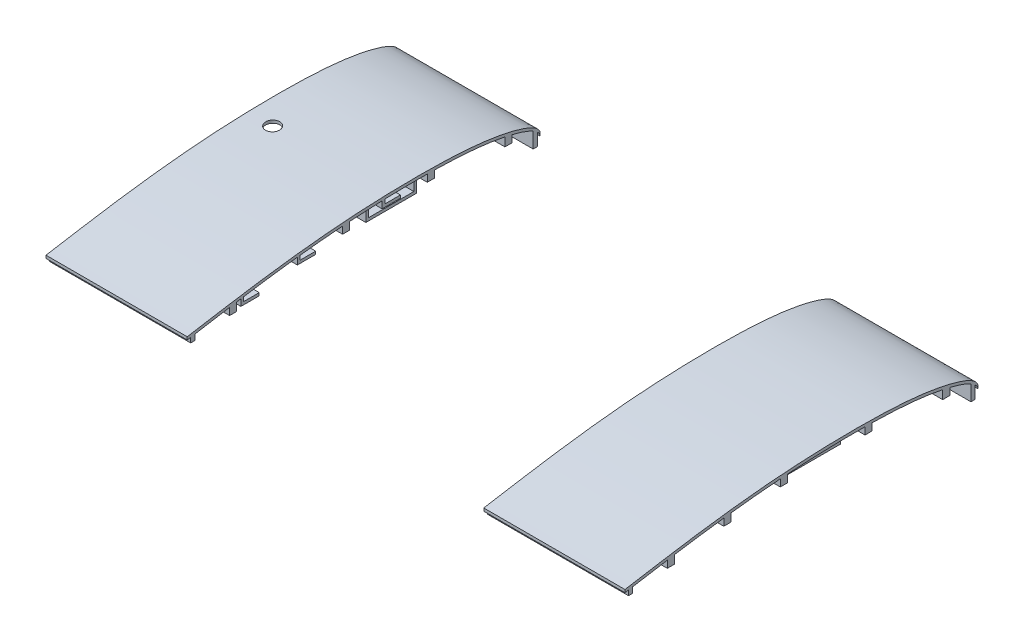
from build123d import *

# Parameters (mm, degrees)
PROFILOCONRINFORZISINISTRO_DEPTH = 105
PROFILOCONRINFORZIDESTRO_DEPTH   = 105
CASSETTOGPS_DEPTH                = 30
CASSETTOGPS_DEPTH_BACK           = 28
SCHIZZO11_W                      = 55
SCHIZZO11_H                      = 12.513248872
CHIUSURACASSETTOGPS_DEPTH        = 2
CASSETTOTELEMETRIA_DEPTH         = 5
CASSETTOTELEMETRIA_DEPTH_BACK    = 45
SCHIZZO13_W                      = 18
SCHIZZO13_H                      = 10.410736535
CHIUSURACASSETTOTELEMETRIA_DEPTH = 2
SCHIZZO14_R                      = 5
FOROANTENNA_DEPTH                = 246.014584546
INCASTRIDENTELLISINISTRA_DEPTH   = 16
INCASTRIDENTELLIDESTRA_DEPTH     = 16
SCHIZZO18_W                      = 3
SCHIZZO18_H                      = 4
INCASTRIVERTICALISINISTRA_DEPTH  = 105
SCHIZZO19_W                      = 3
SCHIZZO19_H                      = 4
INCASTRIVERTICALIDESTRA_DEPTH    = 105
SCHIZZO20_W                      = 5
SCHIZZO20_H                      = 100
TAGLIO_ESTRUSIONE1_DEPTH         = 310
TAGLIO_ESTRUSIONE2_DEPTH         = 37.5
TAGLIO_ESTRUSIONE3_DEPTH         = 37.5


with BuildPart() as part:
    # ProfiloSinistro → ProfiloConRinforziSinistro (new body)
    with BuildSketch(Plane(origin=(-210, 0, 0), x_dir=(0, 0, -1), z_dir=(1, 0, 0))):
        with BuildLine():
            Line((-125, 43.17), (-125, 41.17))
            add(Edge.make_bspline(
                [(-95.000000007, 46.142964166), (-96.383559705, 45.913395163), (-100.327264747, 45.260130481), (-106.363413337, 44.351808874), (-112.746440904, 43.268942418), (-117.622069366, 42.415861917), (-121.644529332, 41.722864946), (-123.32839844, 41.416216765), (-124.999773563, 41.177977377), (-125, 41.17)],
                knots=[0.940049334, 0.940049334, 0.940049334, 0.940049334, 0.948342069, 0.963693004, 0.976235918, 0.986320059, 0.993788799, 0.998424035, 1, 1, 1, 1], degree=3))
            Line((-95.000000007, 46.142964166), (-95.000000007, 41.142964164))
            Line((-95.000000007, 41.142964164), (-90.000000009, 41.142964164))
            Line((-90.000000009, 41.142964164), (-90.000000009, 46.962212447))
            add(Edge.make_bspline(
                [(-55.000000002, 51.955469397), (-56.843173428, 51.723048955), (-62.307110823, 51.017942767), (-71.163081699, 49.802379124), (-80.98405898, 48.34835521), (-87.188777011, 47.411025673), (-90.000000009, 46.962212447)],
                knots=[0.860366078, 0.860366078, 0.860366078, 0.860366078, 0.871352858, 0.892947449, 0.913230871, 0.930064087, 0.930064087, 0.930064087, 0.930064087], degree=3))
            Line((-55.000000002, 51.955469397), (-55.000000002, 46.955469399))
            Line((-55.000000002, 46.955469399), (-50.000000002, 46.955469399))
            Line((-50.000000002, 46.955469399), (-50.000000002, 52.572388125))
            add(Edge.make_bspline(
                [(-14.999999994, 56.019629308), (-18.379417541, 55.767295402), (-25.814226898, 55.157245068), (-37.191375056, 54.051586985), (-45.474241435, 53.116208177), (-49.708350468, 52.607567246), (-50.000000002, 52.572388125)],
                knots=[0.781098899, 0.781098899, 0.781098899, 0.781098899, 0.801140184, 0.825214387, 0.848697424, 0.850434727, 0.850434727, 0.850434727, 0.850434727], degree=3))
            Line((-14.999999994, 56.019629308), (-14.999999994, 51.019629308))
            Line((-14.999999994, 51.019629308), (-9.999999995, 51.019629308))
            Line((-9.999999995, 51.019629308), (-9.999999995, 56.374624202))
            add(Edge.make_bspline(
                [(45.000080295, 57.965037997), (42.188516749, 57.996145507), (35.352175978, 58.022351628), (24.403000114, 57.89671529), (12.111174018, 57.553385062), (0.613038682, 57.037092747), (-6.769741769, 56.592120119), (-9.999999995, 56.374624202)],
                knots=[0.662723528, 0.662723528, 0.662723528, 0.662723528, 0.679351894, 0.703152303, 0.727478208, 0.752070739, 0.771217511, 0.771217511, 0.771217511, 0.771217511], degree=3))
            Line((45.000080295, 57.965037997), (45.000080295, 52.887723635))
            Line((45.000080295, 52.887723635), (50.000080294, 52.887723635))
            Line((50.000080294, 52.887723635), (50.000080294, 57.887723634))
            add(Edge.make_bspline(
                [(100.000080297, 53.212006285), (98.926491228, 53.435110632), (95.159056127, 54.175343839), (88.392626594, 55.267834907), (79.42697156, 56.329429016), (69.667089926, 57.130903997), (59.768729904, 57.634304846), (53.131645999, 57.825139827), (50.000080294, 57.887723634)],
                knots=[0.553736641, 0.553736641, 0.553736641, 0.553736641, 0.560220779, 0.576438923, 0.594258689, 0.613600245, 0.634342386, 0.65286581, 0.65286581, 0.65286581, 0.65286581], degree=3))
            Line((100.000080297, 53.212006285), (100.000080297, 47.078985013))
            Line((100.000080297, 47.078985013), (105.000080295, 47.078985013))
            Line((105.000080295, 47.078985013), (105.000080295, 52.078985012))
            add(Edge.make_bspline(
                [(125.000080295, 41.18724985), (125.000080295, 41.245823225), (124.966052724, 41.968038807), (124.187400758, 43.475684336), (122.271136483, 45.408352423), (119.230092759, 47.28817212), (115.119057196, 49.0835942), (110.255807, 50.701301925), (106.750993245, 51.647024395), (105.000080295, 52.078985012)],
                knots=[0.496943959, 0.496943959, 0.496943959, 0.496943959, 0.497289785, 0.501214273, 0.50645795, 0.513356957, 0.522168632, 0.53296597, 0.543630389, 0.543630389, 0.543630389, 0.543630389], degree=3))
            Line((125.000080295, 41.18724985), (125.000080295, 43.187249851))
            add(Edge.make_bspline(
                [(125.000080295, 43.187249851), (125.000080295, 43.245823226), (124.966052724, 43.968038809), (124.187400758, 45.475684337), (122.271136483, 47.408352424), (119.230092759, 49.288172121), (115.119057196, 51.083594202), (109.925069532, 52.811318178), (103.701247778, 54.453896488), (96.50282788, 55.958381759), (88.392626594, 57.267834908), (79.42697156, 58.329429017), (69.667089926, 59.130903998), (59.183463502, 59.664069738), (48.06862374, 59.961989705), (36.433050972, 60.034754131), (24.403000114, 59.896715291), (12.111174018, 59.553385064), (-0.311615819, 58.995573667), (-12.743791097, 58.22233187), (-25.072384382, 57.229339074), (-37.191375056, 56.051586986), (-48.989074322, 54.719280346), (-60.352364446, 53.286249729), (-71.163081698, 51.802379125), (-81.300441402, 50.301513884), (-90.560350587, 48.901221768), (-98.977157043, 47.463295127), (-106.363413336, 46.351808874), (-112.746440904, 45.268942417), (-117.622069366, 44.415861917), (-121.644529332, 43.722864946), (-123.32839844, 43.416216765), (-124.999773563, 43.177977377), (-125, 43.17)],
                knots=[0.496943959, 0.496943959, 0.496943959, 0.496943959, 0.497289785, 0.501214273, 0.50645795, 0.513356957, 0.522168632, 0.53296597, 0.545689209, 0.560220779, 0.576438923, 0.594258689, 0.613600245, 0.634342386, 0.656331109, 0.679351894, 0.703152303, 0.727478208, 0.752070739, 0.776691164, 0.801140184, 0.825214387, 0.848697424, 0.871352858, 0.892947449, 0.913230871, 0.931955467, 0.948342069, 0.963693004, 0.976235918, 0.986320059, 0.993788799, 0.998424035, 1, 1, 1, 1], degree=3))
        make_face()
    extrude(amount=PROFILOCONRINFORZISINISTRO_DEPTH)

    # Schizzo12 → CassettoTelemetria (add, two sides: drawn at the far end of the back side and taken through both)
    with BuildSketch(Plane.ZY.offset(157.5).offset(-CASSETTOTELEMETRIA_DEPTH_BACK)):
        Polygon((-45.000010196, 57.983772629), (-45.000010196, 42.4769871), (-9.000010196, 42.4769871), (-9.000010196, 57.4769871), (-11.000010196, 57.4769871), (-11.000010196, 44.4769871), (-43.000010196, 44.4769871), (-43.000010196, 57.983772629), align=None)
    extrude(amount=CASSETTOTELEMETRIA_DEPTH + CASSETTOTELEMETRIA_DEPTH_BACK)

    # Schizzo13 → ChiusuraCassettoTelemetria (add)
    with BuildSketch(Plane.ZY.offset(162.5)):
        with Locations((-36.000010196, 47.682355368)):
            Rectangle(SCHIZZO13_W, SCHIZZO13_H)
    extrude(amount=-CHIUSURACASSETTOTELEMETRIA_DEPTH)

    # Schizzo14 → ForoAntenna (cut, through all)
    with BuildSketch(Plane.XZ.offset(-42.4769871)):
        with Locations(Location((-187.5, -18.000010196, 0), (0, 0, 270))):
            Circle(SCHIZZO14_R)
    extrude(amount=-FOROANTENNA_DEPTH, mode=Mode.SUBTRACT)

    # Schizzo15 → IncastriDentelliSinistra (add)
    with BuildSketch(Plane.ZY.offset(105)):
        Polygon((87, 47.739245188), (87, 42.739245188), (74, 42.739245188), (74, 44.739245188), (85, 44.739245188), (85, 47.739245188), align=None)
        Polygon((-13.000080295, 57.617856056), (-13.000080295, 52.617856056), (-26.000080295, 52.617856056), (-26.000080295, 54.617856056), (-15.000080295, 54.617856056), (-15.000080295, 57.617856056), align=None)
        Polygon((47, 53.1611578), (47, 48.1611578), (34, 48.1611578), (34, 50.1611578), (45, 50.1611578), (45, 53.1611578), align=None)
    extrude(amount=INCASTRIDENTELLISINISTRA_DEPTH)

    # Schizzo18 → IncastriVerticaliSinistra (add)
    with BuildSketch(Plane.ZY.offset(210)):
        with Locations((121, 40.092491928)):
            Rectangle(SCHIZZO18_W, SCHIZZO18_H)
        Polygon((-123.000080295, 45.762545658), (-120.000080295, 46.762545658), (-120.000080295, 35.762545658), (-123.000080295, 35.762545658), align=None)
    extrude(amount=-INCASTRIVERTICALISINISTRA_DEPTH)


with BuildPart() as body_2:
    # Schizzo5 → ProfiloConRinforziDestro (new body)
    with BuildSketch(Plane(origin=(210, 0, 0), x_dir=(0, 0, -1), z_dir=(1, 0, 0))):
        with BuildLine():
            Line((-125, 43.17), (-125, 41.17))
            add(Edge.make_bspline(
                [(-95, 46.142964166), (-96.383559701, 45.913395163), (-100.327264745, 45.26013048), (-106.363413337, 44.351808874), (-112.746440905, 43.268942417), (-117.622069366, 42.415861917), (-121.644529333, 41.722864946), (-123.32839844, 41.416216765), (-124.999773563, 41.177977377), (-125, 41.17)],
                knots=[0.940049334, 0.940049334, 0.940049334, 0.940049334, 0.948342069, 0.963693004, 0.976235918, 0.986320059, 0.993788799, 0.998424035, 1, 1, 1, 1], degree=3))
            Line((-95, 46.142964166), (-95, 41.142964166))
            Line((-95, 41.142964166), (-90, 41.142964166))
            Line((-90, 41.142964166), (-90, 46.962212449))
            add(Edge.make_bspline(
                [(-55, 51.955469401), (-56.843173427, 51.723048958), (-62.307110822, 51.01794277), (-71.1630817, 49.802379126), (-80.984058977, 48.348355212), (-87.188777005, 47.411025675), (-90, 46.962212449)],
                knots=[0.860366078, 0.860366078, 0.860366078, 0.860366078, 0.871352858, 0.892947449, 0.913230871, 0.930064087, 0.930064087, 0.930064087, 0.930064087], degree=3))
            Line((-55, 51.955469401), (-55, 46.955469399))
            Line((-55, 46.955469399), (-50, 46.955469399))
            Line((-50, 46.955469399), (-50, 52.572388127))
            add(Edge.make_bspline(
                [(-15, 56.019629309), (-18.379417546, 55.767295403), (-25.814226902, 55.157245069), (-37.191375059, 54.051586986), (-45.474241436, 53.116208179), (-49.708350467, 52.607567248), (-50, 52.572388127)],
                knots=[0.781098899, 0.781098899, 0.781098899, 0.781098899, 0.801140184, 0.825214387, 0.848697424, 0.850434727, 0.850434727, 0.850434727, 0.850434727], degree=3))
            Line((-15, 56.019629309), (-15, 51.019629308))
            Line((-15, 51.019629308), (-10.000000006, 51.019629308))
            Line((-10.000000006, 51.019629308), (-10.000000006, 56.374624203))
            add(Edge.make_bspline(
                [(45.000080282, 57.965037999), (42.188516738, 57.996145508), (35.35217597, 58.022351629), (24.403000109, 57.896715292), (12.111174012, 57.553385064), (0.613038675, 57.037092748), (-6.769741777, 56.59212012), (-10.000000006, 56.374624203)],
                knots=[0.662723528, 0.662723528, 0.662723528, 0.662723528, 0.679351894, 0.703152303, 0.727478208, 0.752070739, 0.771217511, 0.771217511, 0.771217511, 0.771217511], degree=3))
            Line((45.000080282, 57.965037999), (45.000080282, 52.887723636))
            Line((45.000080282, 52.887723636), (50.000080295, 52.887723636))
            Line((50.000080295, 52.887723636), (50.000080295, 57.887723635))
            add(Edge.make_bspline(
                [(100.000080295, 53.212006286), (98.926491227, 53.435110633), (95.159056127, 54.17534384), (88.392626594, 55.267834907), (79.42697156, 56.329429017), (69.667089926, 57.130903998), (59.768729905, 57.634304847), (53.131646, 57.825139828), (50.000080295, 57.887723635)],
                knots=[0.553736641, 0.553736641, 0.553736641, 0.553736641, 0.560220779, 0.576438923, 0.594258689, 0.613600245, 0.634342386, 0.65286581, 0.65286581, 0.65286581, 0.65286581], degree=3))
            Line((100.000080295, 53.212006286), (100.000080295, 47.078985013))
            Line((100.000080295, 47.078985013), (105.000080295, 47.078985013))
            Line((105.000080295, 47.078985013), (105.000080295, 52.078985012))
            add(Edge.make_bspline(
                [(125.000080295, 41.187249851), (125.000080295, 41.245823225), (124.966052724, 41.968038808), (124.187400758, 43.475684336), (122.271136483, 45.408352423), (119.230092759, 47.28817212), (115.119057196, 49.083594201), (110.255807, 50.701301926), (106.750993245, 51.647024395), (105.000080295, 52.078985012)],
                knots=[0.496943959, 0.496943959, 0.496943959, 0.496943959, 0.497289785, 0.501214273, 0.50645795, 0.513356957, 0.522168632, 0.53296597, 0.543630389, 0.543630389, 0.543630389, 0.543630389], degree=3))
            Line((125.000080295, 41.187249851), (125.000080295, 43.187249851))
            add(Edge.make_bspline(
                [(125.000080295, 43.187249851), (125.000080295, 43.245823226), (124.966052724, 43.968038809), (124.187400758, 45.475684337), (122.271136483, 47.408352424), (119.230092759, 49.288172121), (115.119057196, 51.083594202), (109.925069532, 52.811318178), (103.701247778, 54.453896488), (96.50282788, 55.958381759), (88.392626594, 57.267834908), (79.42697156, 58.329429017), (69.667089926, 59.130903998), (59.183463502, 59.664069738), (48.06862374, 59.961989705), (36.433050972, 60.034754131), (24.403000114, 59.896715291), (12.111174018, 59.553385064), (-0.311615819, 58.995573667), (-12.743791097, 58.22233187), (-25.072384382, 57.229339074), (-37.191375056, 56.051586986), (-48.989074322, 54.719280346), (-60.352364446, 53.286249729), (-71.163081698, 51.802379125), (-81.300441402, 50.301513884), (-90.560350587, 48.901221768), (-98.977157043, 47.463295127), (-106.363413336, 46.351808874), (-112.746440904, 45.268942417), (-117.622069366, 44.415861917), (-121.644529332, 43.722864946), (-123.32839844, 43.416216765), (-124.999773563, 43.177977377), (-125, 43.17)],
                knots=[0.496943959, 0.496943959, 0.496943959, 0.496943959, 0.497289785, 0.501214273, 0.50645795, 0.513356957, 0.522168632, 0.53296597, 0.545689209, 0.560220779, 0.576438923, 0.594258689, 0.613600245, 0.634342386, 0.656331109, 0.679351894, 0.703152303, 0.727478208, 0.752070739, 0.776691164, 0.801140184, 0.825214387, 0.848697424, 0.871352858, 0.892947449, 0.913230871, 0.931955467, 0.948342069, 0.963693004, 0.976235918, 0.986320059, 0.993788799, 0.998424035, 1, 1, 1, 1], degree=3))
        make_face()
    extrude(amount=-PROFILOCONRINFORZIDESTRO_DEPTH)

    # Schizzo10 → CassettoGPS (add, two sides: drawn at the far end of the back side and taken through both)
    with BuildSketch(Plane(origin=(157.5, 0, 0), x_dir=(0, 0, -1), z_dir=(1, 0, 0)).offset(-CASSETTOGPS_DEPTH_BACK)):
        Polygon((-10.000000006, 56.506380436), (-10.000000006, 38.506380436), (44.999999994, 38.506380436), (44.999999994, 57.983772709), (42.999999994, 57.983772709), (42.999999994, 40.506380436), (-8.000000006, 40.506380436), (-8.000000006, 56.506380436), align=None)
    extrude(amount=CASSETTOGPS_DEPTH + CASSETTOGPS_DEPTH_BACK)

    # Schizzo11 → ChiusuraCassettoGPS (add)
    with BuildSketch(Plane(origin=(187.5, 0, 0), x_dir=(0, 0, -1), z_dir=(1, 0, 0))):
        with Locations((17.499999994, 44.763004872)):
            Rectangle(SCHIZZO11_W, SCHIZZO11_H)
    extrude(amount=-CHIUSURACASSETTOGPS_DEPTH)

    # Schizzo16 → IncastriDentelliDestra (add)
    with BuildSketch(Plane.ZY.offset(-105)):
        Polygon((-26.000080295, 54.617856056), (-15.000080295, 54.617856056), (-15.000080295, 57.617856056), (-13.000080295, 57.617856056), (-13.000080295, 52.617856056), (-26.000080295, 52.617856056), align=None)
        Polygon((45, 53.1611578), (47, 53.1611578), (47, 48.1611578), (34, 48.1611578), (34, 50.1611578), (45, 50.1611578), align=None)
        Polygon((74, 44.739245188), (74, 42.739245188), (87, 42.739245188), (87, 47.739245188), (85, 47.739245188), (85, 44.739245188), align=None)
    extrude(amount=-INCASTRIDENTELLIDESTRA_DEPTH)

    # Schizzo19 → IncastriVerticaliDestra (add)
    with BuildSketch(Plane(origin=(210, 0, 0), x_dir=(0, 0, -1), z_dir=(1, 0, 0))):
        with Locations((-121, 40.092491928)):
            Rectangle(SCHIZZO19_W, SCHIZZO19_H)
        Polygon((120.000080295, 46.762545658), (120.000080295, 35.762545658), (123.000080295, 35.762545658), (123.000080295, 45.762545658), align=None)
    extrude(amount=-INCASTRIVERTICALIDESTRA_DEPTH)


with BuildPart() as taglio_estrusione1_tool:
    # Schizzo20 → Taglio-Estrusione1 (new body)
    with BuildSketch(Plane(origin=(0, 0, -125.000080295), x_dir=(-1, 0, 0), z_dir=(0, 0, -1))):
        with Locations((-207.5, 50)):
            Rectangle(SCHIZZO20_W, SCHIZZO20_H)
        with Locations((207.5, 50)):
            Rectangle(SCHIZZO20_W, SCHIZZO20_H)
    extrude(amount=-TAGLIO_ESTRUSIONE1_DEPTH)


with BuildPart() as part_1:
    add(part.part)

    # Taglio-Estrusione1: cut by taglio_estrusione1_tool
    add(taglio_estrusione1_tool.part, mode=Mode.SUBTRACT)

    # Schizzo21 → Taglio-Estrusione2 (cut)
    with BuildSketch(Plane(origin=(-105, 0, 0), x_dir=(0, 0, -1), z_dir=(1, 0, 0))):
        Polygon((-55, 46.955469399), (-50, 46.955469399), (-50, 52.572388127), (-55, 51.955469401), align=None)
    extrude(amount=-TAGLIO_ESTRUSIONE2_DEPTH, mode=Mode.SUBTRACT)


with BuildPart() as body_2_1:
    add(body_2.part)

    # Taglio-Estrusione1: cut by taglio_estrusione1_tool
    add(taglio_estrusione1_tool.part, mode=Mode.SUBTRACT)

    # Schizzo22 → Taglio-Estrusione3 (cut)
    with BuildSketch(Plane.ZY.offset(-105)):
        Polygon((50.000000002, 46.955469399), (55.000000002, 46.955469399), (55.000000002, 51.955469397), (50.000000002, 52.572388125), align=None)
    extrude(amount=-TAGLIO_ESTRUSIONE3_DEPTH, mode=Mode.SUBTRACT)


solid = Compound([part_1.part, body_2_1.part])
